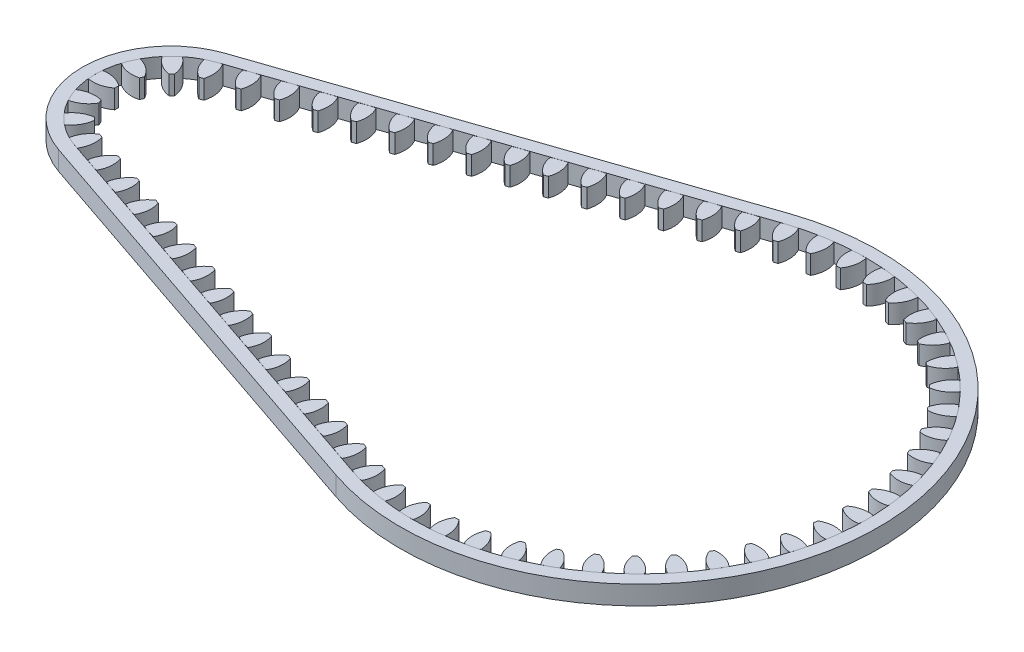
from build123d import *

# Parameters (mm, degrees)
BOSS_EXTRUDE1_DEPTH = 6
BOSS_EXTRUDE2_DEPTH = 6
CRVPATTERN1_DEPTH   = 6


# Read off the part's stored shape, not the designer's step: CrvPattern1
with BuildPart() as part:
    # Sketch1 → Boss-Extrude1 (new body)
    with BuildSketch(Plane(origin=(0, 0, 0), x_dir=(1, 0, 0), z_dir=(0, 1, 0))):
        with BuildLine():
            Line((-9.020134228, -26.507304248), (124.516778523, -71.948397245))
            ThreePointArc((124.516778523, -71.948397245), (225, 0), (124.516778523, 71.948397245))
            Line((124.516778523, 71.948397245), (-9.020134228, 26.507304248))
            ThreePointArc((-9.020134228, 26.507304248), (-28, 0), (-9.020134228, -26.507304248))
        make_face()
        with BuildLine():
            ThreePointArc((125.805369128, -68.161639495), (221, 0), (125.805369128, 68.161639495))
            Line((125.805369128, 68.161639495), (-7.731543624, 22.720546498))
            ThreePointArc((-7.731543624, 22.720546498), (-24, 0), (-7.731543624, -22.720546498))
            Line((-7.731543624, -22.720546498), (125.805369128, -68.161639495))
        make_face(mode=Mode.SUBTRACT)
    extrude(amount=BOSS_EXTRUDE1_DEPTH)


with BuildPart() as body_2:
    # Sketch4 → Boss-Extrude2 (new body)
    with BuildSketch(Plane(origin=(0, 0, 0), x_dir=(-1, 0, 0), z_dir=(0, -1, 0))):
        with BuildLine():
            ThreePointArc((17.101526887, -0.635252012), (20.322077388, -2.182192533), (23.894229865, -2.250728579))
            ThreePointArc((23.894229865, -2.250728579), (24, 0), (23.894229865, 2.250728579))
            ThreePointArc((23.894229865, 2.250728579), (20.322077388, 2.182192533), (17.101526887, 0.635252012))
            ThreePointArc((17.101526887, 0.635252012), (17.093118224, 0), (17.101526887, -0.635252012))
        make_face()
    extrude(amount=-BOSS_EXTRUDE2_DEPTH)


with BuildPart() as body_3:
    # CrvPattern1 outline → CrvPattern1 (new body)
    with BuildSketch(Plane(origin=(0, 0, 0), x_dir=(1, 0, 0), z_dir=(0, 1, 0))):
        with BuildLine():
            ThreePointArc((-21.125479122, -11.389211204), (-17.862776307, -9.933278222), (-15.500293176, -7.253046149))
            ThreePointArc((-15.500293176, -7.253046149), (-15.740241757, -6.664794075), (-15.995676615, -6.08309926))
            ThreePointArc((-15.995676615, -6.08309926), (-19.564497862, -5.91432304), (-22.880646588, -7.244032835))
            ThreePointArc((-22.880646588, -7.244032835), (-22.100461555, -9.357862954), (-21.125479122, -11.389211204))
        make_face()
        with BuildLine():
            ThreePointArc((-18.245884714, -15.591269704), (-16.703318632, -17.233663183), (-15.013526527, -18.724156088))
            ThreePointArc((-15.013526527, -18.724156088), (-12.576623448, -16.11140392), (-11.446022228, -12.722198793))
            ThreePointArc((-11.446022228, -12.722198793), (-11.896325005, -12.274043425), (-12.358332162, -11.837964063))
            ThreePointArc((-12.358332162, -11.837964063), (-15.710554375, -13.07391582), (-18.245884714, -15.591269704))
        make_face()
        with BuildLine():
            ThreePointArc((-10.722052923, -21.471785699), (-8.661168144, -22.382675586), (-6.523942288, -23.096280588))
            ThreePointArc((-6.523942288, -23.096280588), (-5.29873424, -19.740116744), (-5.579190008, -16.178331368))
            ThreePointArc((-5.579190008, -16.178331368), (-6.168598793, -15.941238331), (-6.764076649, -15.719829327))
            ThreePointArc((-6.764076649, -15.719829327), (-9.369009868, -18.165088707), (-10.722052923, -21.471785699))
        make_face()
        with BuildLine():
            ThreePointArc((-6.523942289, 23.096280588), (-8.661168144, 22.382675586), (-10.722052923, 21.471785699))
            ThreePointArc((-10.722052923, 21.471785699), (-9.369009868, 18.165088707), (-6.76407665, 15.719829327))
            ThreePointArc((-6.76407665, 15.719829327), (-6.168598794, 15.941238331), (-5.579190008, 16.178331367))
            ThreePointArc((-5.579190008, 16.178331367), (-5.29873424, 19.740116744), (-6.523942289, 23.096280588))
        make_face()
        with BuildLine():
            ThreePointArc((-15.013526527, 18.724156088), (-16.703318632, 17.233663183), (-18.245884714, 15.591269704))
            ThreePointArc((-18.245884714, 15.591269704), (-15.710554375, 13.07391582), (-12.358332162, 11.837964063))
            ThreePointArc((-12.358332162, 11.837964063), (-11.896325004, 12.274043425), (-11.446022228, 12.722198793))
            ThreePointArc((-11.446022228, 12.722198793), (-12.576623448, 16.11140392), (-15.013526527, 18.724156088))
        make_face()
        with BuildLine():
            ThreePointArc((-21.125479122, 11.389211204), (-22.100461555, 9.357862954), (-22.880646588, 7.244032835))
            ThreePointArc((-22.880646588, 7.244032835), (-19.564497862, 5.91432304), (-15.995676615, 6.08309926))
            ThreePointArc((-15.995676615, 6.08309926), (-15.740241757, 6.664794075), (-15.500293176, 7.253046149))
            ThreePointArc((-15.500293176, 7.253046149), (-17.862776307, 9.933278222), (-21.125479122, 11.389211204))
        make_face()
        with BuildLine():
            ThreePointArc((2.596033966, -26.123177392), (3.681912144, -22.719379647), (3.254932671, -19.172175249))
            ThreePointArc((3.254932671, -19.172175249), (2.656255133, -18.959569913), (2.052159932, -18.762885362))
            ThreePointArc((2.052159932, -18.762885362), (-0.449805099, -21.31340325), (-1.665447979, -24.673043543))
            ThreePointArc((-1.665447979, -24.673043543), (0.431219393, -25.498241936), (2.596033966, -26.123177392))
        make_face()
        with BuildLine():
            ThreePointArc((11.696335101, -29.219906391), (12.78221328, -25.816108646), (12.355233807, -22.268904249))
            ThreePointArc((12.355233807, -22.268904249), (11.756556268, -22.056298913), (11.152461067, -21.859614362))
            ThreePointArc((11.152461067, -21.859614362), (8.650496036, -24.410132249), (7.434853156, -27.769772542))
            ThreePointArc((7.434853156, -27.769772542), (9.531520528, -28.594970936), (11.696335101, -29.219906391))
        make_face()
        with BuildLine():
            ThreePointArc((20.796636236, -32.316635391), (21.882514415, -28.912837646), (21.455534942, -25.365633248))
            ThreePointArc((21.455534942, -25.365633248), (20.856857404, -25.153027912), (20.252762203, -24.956343361))
            ThreePointArc((20.252762203, -24.956343361), (17.750797172, -27.506861248), (16.535154292, -30.866501541))
            ThreePointArc((16.535154292, -30.866501541), (18.631821664, -31.691699935), (20.796636236, -32.316635391))
        make_face()
        with BuildLine():
            ThreePointArc((29.895921487, -35.413018696), (30.981799665, -32.009220951), (30.554820192, -28.462016553))
            ThreePointArc((30.554820192, -28.462016553), (29.956142654, -28.249411217), (29.352047453, -28.052726666))
            ThreePointArc((29.352047453, -28.052726666), (26.850082422, -30.603244553), (25.634439542, -33.962884846))
            ThreePointArc((25.634439542, -33.962884846), (27.731106914, -34.78808324), (29.895921487, -35.413018696))
        make_face()
        with BuildLine():
            ThreePointArc((38.995206737, -38.509402001), (40.081084915, -35.105604256), (39.654105442, -31.558399858))
            ThreePointArc((39.654105442, -31.558399858), (39.055427904, -31.345794522), (38.451332703, -31.149109971))
            ThreePointArc((38.451332703, -31.149109971), (35.949367672, -33.699627858), (34.733724792, -37.059268151))
            ThreePointArc((34.733724792, -37.059268151), (36.830392164, -37.884466545), (38.995206737, -38.509402001))
        make_face()
        with BuildLine():
            ThreePointArc((48.095507872, -41.606131), (49.181386051, -38.202333255), (48.754406578, -34.655128857))
            ThreePointArc((48.754406578, -34.655128857), (48.155729039, -34.442523522), (47.551633838, -34.245838971))
            ThreePointArc((47.551633838, -34.245838971), (45.049668808, -36.796356859), (43.834025927, -40.155997151))
            ThreePointArc((43.834025927, -40.155997151), (45.930693299, -40.981195545), (48.095507872, -41.606131))
        make_face()
        with BuildLine():
            ThreePointArc((57.195809008, -44.702859999), (58.281687186, -41.299062254), (57.854707713, -37.751857857))
            ThreePointArc((57.854707713, -37.751857857), (57.256030175, -37.539252521), (56.651934974, -37.34256797))
            ThreePointArc((56.651934974, -37.34256797), (54.149969943, -39.893085857), (52.934327063, -43.25272615))
            ThreePointArc((52.934327063, -43.25272615), (55.030994435, -44.077924544), (57.195809008, -44.702859999))
        make_face()
        with BuildLine():
            ThreePointArc((66.296110143, -47.799588999), (67.381988322, -44.395791254), (66.955008849, -40.848586856))
            ThreePointArc((66.955008849, -40.848586856), (66.35633131, -40.63598152), (65.752236109, -40.439296969))
            ThreePointArc((65.752236109, -40.439296969), (63.250271078, -42.989814856), (62.034628198, -46.349455149))
            ThreePointArc((62.034628198, -46.349455149), (64.13129557, -47.174653543), (66.296110143, -47.799588999))
        make_face()
        with BuildLine():
            ThreePointArc((75.396411279, -50.896317998), (76.482289457, -47.492520253), (76.055309984, -43.945315855))
            ThreePointArc((76.055309984, -43.945315855), (75.456632446, -43.732710519), (74.852537245, -43.536025968))
            ThreePointArc((74.852537245, -43.536025968), (72.350572214, -46.086543856), (71.134929334, -49.446184149))
            ThreePointArc((71.134929334, -49.446184149), (73.231596706, -50.271382543), (75.396411279, -50.896317998))
        make_face()
        with BuildLine():
            ThreePointArc((84.495696529, -53.992701303), (85.581574707, -50.588903558), (85.154595234, -47.04169916))
            ThreePointArc((85.154595234, -47.04169916), (84.555917695, -46.829093825), (83.951822495, -46.632409274))
            ThreePointArc((83.951822495, -46.632409274), (81.449857464, -49.182927161), (80.234214584, -52.542567454))
            ThreePointArc((80.234214584, -52.542567454), (82.330881956, -53.367765848), (84.495696529, -53.992701303))
        make_face()
        with BuildLine():
            ThreePointArc((93.594981779, -57.089084608), (94.680859958, -53.685286863), (94.253880485, -50.138082465))
            ThreePointArc((94.253880485, -50.138082465), (93.655202946, -49.92547713), (93.051107745, -49.728792579))
            ThreePointArc((93.051107745, -49.728792579), (90.549142714, -52.279310466), (89.333499834, -55.638950759))
            ThreePointArc((89.333499834, -55.638950759), (91.430167206, -56.464149153), (93.594981779, -57.089084608))
        make_face()
        with BuildLine():
            ThreePointArc((102.695282914, -60.185813608), (103.781161093, -56.782015863), (103.35418162, -53.234811465))
            ThreePointArc((103.35418162, -53.234811465), (102.755504081, -53.022206129), (102.151408881, -52.825521578))
            ThreePointArc((102.151408881, -52.825521578), (99.64944385, -55.376039465), (98.43380097, -58.735679758))
            ThreePointArc((98.43380097, -58.735679758), (100.530468342, -59.560878152), (102.695282914, -60.185813608))
        make_face()
        with BuildLine():
            ThreePointArc((111.79558405, -63.282542607), (112.881462229, -59.878744862), (112.454482755, -56.331540464))
            ThreePointArc((112.454482755, -56.331540464), (111.855805217, -56.118935128), (111.251710016, -55.922250577))
            ThreePointArc((111.251710016, -55.922250577), (108.749744985, -58.472768464), (107.534102105, -61.832408757))
            ThreePointArc((107.534102105, -61.832408757), (109.630769477, -62.657607151), (111.79558405, -63.282542607))
        make_face()
        with BuildLine():
            ThreePointArc((120.895885185, -66.379271606), (121.981763364, -62.975473861), (121.554783891, -59.428269463))
            ThreePointArc((121.554783891, -59.428269463), (120.956106352, -59.215664128), (120.352011152, -59.018979577))
            ThreePointArc((120.352011152, -59.018979577), (117.850046121, -61.569497464), (116.63440324, -64.929137757))
            ThreePointArc((116.63440324, -64.929137757), (118.731070612, -65.754336151), (120.895885185, -66.379271606))
        make_face()
        with BuildLine():
            ThreePointArc((130.02301791, -69.38097879), (131.007294776, -65.94642357), (130.475121352, -62.413469854))
            ThreePointArc((130.475121352, -62.413469854), (129.870391865, -62.218744223), (129.260720091, -62.040093301))
            ThreePointArc((129.260720091, -62.040093301), (126.835631694, -64.663815233), (125.72033555, -68.058087618))
            ThreePointArc((125.72033555, -68.058087618), (127.840592934, -68.820632754), (130.02301791, -69.38097879))
        make_face()
        with BuildLine():
            ThreePointArc((139.426681005, -71.289533808), (139.945050702, -67.754528381), (138.947366021, -64.323843932))
            ThreePointArc((138.947366021, -64.323843932), (138.322098734, -64.211342181), (137.694072726, -64.115429942))
            ThreePointArc((137.694072726, -64.115429942), (135.639787249, -67.038592901), (134.986202291, -70.551112967))
            ThreePointArc((134.986202291, -70.551112967), (137.189091073, -71.024660719), (139.426681005, -71.289533808))
        make_face()
        with BuildLine():
            ThreePointArc((149.001746129, -71.929451993), (149.044932351, -68.356903119), (147.599443546, -65.08955976))
            ThreePointArc((147.599443546, -65.08955976), (146.964765029, -65.061293091), (146.329560693, -65.049835527))
            ThreePointArc((146.329560693, -65.049835527), (144.682681106, -68.220444007), (144.502489809, -71.788707115))
            ThreePointArc((144.502489809, -71.788707115), (146.748810905, -71.964797976), (149.001746129, -71.929451993))
        make_face()
        with BuildLine():
            ThreePointArc((158.575488081, -71.289242492), (158.142786419, -67.742731561), (156.275277532, -64.696852203))
            ThreePointArc((156.275277532, -64.696852203), (155.642483661, -64.753312278), (155.011405928, -64.826501887))
            ThreePointArc((155.011405928, -64.826501887), (153.801184775, -68.188099018), (154.097529903, -71.748597589))
            ThreePointArc((154.097529903, -71.748597589), (156.347302397, -71.624138023), (158.575488081, -71.289242492))
        make_face()
        with BuildLine():
            ThreePointArc((167.98034737, -69.380058236), (167.079382365, -65.922713508), (164.823024673, -63.152547362))
            ThreePointArc((164.823024673, -63.152547362), (164.203378795, -63.292742975), (163.587660831, -63.449290773))
            ThreePointArc((163.587660831, -63.449290773), (162.835709458, -66.942074712), (163.603393573, -70.431434482))
            ThreePointArc((163.603393573, -70.431434482), (165.816574518, -70.008591055), (167.98034737, -69.380058236))
        make_face()
        with BuildLine():
            ThreePointArc((177.046671732, -66.23617042), (175.693514728, -62.929520055), (173.088497247, -60.484350443))
            ThreePointArc((173.088497247, -60.484350443), (172.493027022, -60.705779968), (171.903626407, -60.942893315))
            ThreePointArc((171.903626407, -60.942893315), (171.623293378, -64.504688354), (172.84861708, -67.860809975))
            ThreePointArc((172.84861708, -67.860809975), (174.985818343, -67.147131324), (177.046671732, -66.23617042))
        make_face()
        with BuildLine():
            ThreePointArc((185.613835402, -61.913432503), (183.832569207, -58.8163272), (180.925254976, -56.739672565))
            ThreePointArc((180.925254976, -56.739672565), (180.364558389, -57.038395114), (179.811965085, -57.351853987))
            ThreePointArc((179.811965085, -57.351853987), (180.008239898, -60.919268556), (181.669395514, -64.082420865))
            ThreePointArc((181.669395514, -64.082420865), (183.692579886, -63.090608658), (185.613835402, -61.913432503))
        make_face()
        with BuildLine():
            ThreePointArc((193.528471483, -56.489479502), (191.350842942, -53.657006299), (188.193001595, -51.985776652))
            ThreePointArc((188.193001595, -51.985776652), (187.677051913, -52.356467561), (187.171094756, -52.74068518))
            ThreePointArc((187.171094756, -52.74068518), (187.840429071, -56.250238155), (189.907806164, -59.164156902))
            ThreePointArc((189.907806164, -59.164156902), (191.78098536, -57.911892489), (193.528471483, -56.489479502))
        make_face()
        with BuildLine():
            ThreePointArc((200.652140932, -50.058989245), (198.116829754, -47.541616062), (194.76461695, -46.305638788))
            ThreePointArc((194.76461695, -46.305638788), (194.302606473, -46.741714633), (193.852300285, -47.189866574))
            ThreePointArc((193.852300285, -47.189866574), (194.982875707, -50.579080306), (197.419758897, -53.191851024))
            ThreePointArc((197.419758897, -53.191851024), (199.109562347, -51.701370981), (200.652140932, -50.058989245))
        make_face()
        with BuildLine():
            ThreePointArc((206.855177416, -42.739027987), (204.007373926, -40.581486379), (200.520482961, -39.802665534))
            ThreePointArc((200.520482961, -39.802665534), (200.120622024, -40.296352738), (199.733968508, -40.800450826))
            ThreePointArc((199.733968508, -40.800450826), (201.305570649, -44.009038867), (204.068518697, -46.274229498))
            ThreePointArc((204.068518697, -46.274229498), (205.544914212, -44.572106488), (206.855177416, -42.739027987))
        make_face()
        with BuildLine():
            ThreePointArc((212.030087364, -34.656228213), (208.920396992, -32.897024899), (205.360859377, -32.589352224))
            ThreePointArc((205.360859377, -32.589352224), (205.030283225, -33.131878935), (204.714182944, -33.682965531))
            ThreePointArc((204.714182944, -33.682965531), (206.698959741, -36.653761986), (209.738881509, -38.530953014))
            ThreePointArc((209.738881509, -38.530953014), (210.975528325, -36.64742677), (212.030087364, -34.656228213))
        make_face()
        with BuildLine():
            ThreePointArc((216.082169183, -25.958209584), (212.76598975, -24.628576371), (209.197172401, -24.797435009))
            ThreePointArc((209.197172401, -24.797435009), (208.941750976, -25.379135722), (208.701815981, -25.967393337))
            ThreePointArc((208.701815981, -25.967393337), (211.064361007, -28.647570851), (214.327097444, -30.103428486))
            ThreePointArc((214.327097444, -30.103428486), (215.302032966, -28.07205772), (216.082169183, -25.958209584))
        make_face()
        with BuildLine():
            ThreePointArc((218.940193615, -16.799267371), (215.476553537, -15.922815476), (211.961958408, -16.565148401))
            ThreePointArc((211.961958408, -16.565148401), (211.786228216, -17.175668445), (211.626719347, -17.790625959))
            ThreePointArc((211.626719347, -17.790625959), (214.3249536, -20.132527413), (217.752425418, -21.141193586))
            ThreePointArc((217.752425418, -21.141193586), (218.448331174, -18.998139308), (218.940193615, -16.799267371))
        make_face()
        with BuildLine():
            ThreePointArc((220.554079041, -7.338926335), (217.004590128, -6.931373928), (213.606788495, -8.03587136))
            ThreePointArc((213.606788495, -8.03587136), (213.513898148, -8.664351437), (213.437675482, -9.295070019))
            ThreePointArc((213.437675482, -9.295070019), (216.423659807, -11.256923254), (219.954903462, -11.800328039))
            ThreePointArc((219.954903462, -11.800328039), (220.359320208, -9.583705935), (220.554079041, -7.338926335))
        make_face()
        with BuildLine():
            ThreePointArc((220.894229865, 2.250728579), (217.322077388, 2.182192533), (214.101526887, 0.635252012))
            ThreePointArc((214.101526887, 0.635252012), (214.093118224, 0), (214.101526887, -0.635252012))
            ThreePointArc((214.101526887, -0.635252012), (217.322077388, -2.182192533), (220.894229865, -2.250728579))
            ThreePointArc((220.894229865, -2.250728579), (221, 0), (220.894229865, 2.250728579))
        make_face()
        with BuildLine():
            ThreePointArc((219.954903462, 11.800328039), (216.423659807, 11.256923254), (213.437675482, 9.295070018))
            ThreePointArc((213.437675482, 9.295070018), (213.513898148, 8.664351436), (213.606788495, 8.035871359))
            ThreePointArc((213.606788495, 8.035871359), (217.004590128, 6.931373928), (220.554079041, 7.338926334))
            ThreePointArc((220.554079041, 7.338926334), (220.359320208, 9.583705935), (219.954903462, 11.800328039))
        make_face()
        with BuildLine():
            ThreePointArc((217.752425418, 21.141193585), (214.3249536, 20.132527413), (211.626719347, 17.790625958))
            ThreePointArc((211.626719347, 17.790625958), (211.786228216, 17.175668444), (211.961958408, 16.5651484))
            ThreePointArc((211.961958408, 16.5651484), (215.476553537, 15.922815476), (218.940193615, 16.79926737))
            ThreePointArc((218.940193615, 16.79926737), (218.448331174, 18.998139307), (217.752425418, 21.141193585))
        make_face()
        with BuildLine():
            ThreePointArc((214.327097444, 30.103428485), (211.064361007, 28.64757085), (208.701815981, 25.967393336))
            ThreePointArc((208.701815981, 25.967393336), (208.941750977, 25.379135721), (209.197172402, 24.797435008))
            ThreePointArc((209.197172402, 24.797435008), (212.765989751, 24.628576371), (216.082169183, 25.958209584))
            ThreePointArc((216.082169183, 25.958209584), (215.302032966, 28.07205772), (214.327097444, 30.103428485))
        make_face()
        with BuildLine():
            ThreePointArc((209.738881509, 38.530953013), (206.698959741, 36.653761986), (204.714182945, 33.682965531))
            ThreePointArc((204.714182945, 33.682965531), (205.030283226, 33.131878935), (205.360859377, 32.589352224))
            ThreePointArc((205.360859377, 32.589352224), (208.920396993, 32.897024898), (212.030087364, 34.656228213))
            ThreePointArc((212.030087364, 34.656228213), (210.975528325, 36.647426769), (209.738881509, 38.530953013))
        make_face()
        with BuildLine():
            ThreePointArc((204.068518697, 46.274229498), (201.305570649, 44.009038867), (199.733968508, 40.800450825))
            ThreePointArc((199.733968508, 40.800450825), (200.120622025, 40.296352737), (200.520482961, 39.802665533))
            ThreePointArc((200.520482961, 39.802665533), (204.007373926, 40.581486378), (206.855177416, 42.739027986))
            ThreePointArc((206.855177416, 42.739027986), (205.544914212, 44.572106488), (204.068518697, 46.274229498))
        make_face()
        with BuildLine():
            ThreePointArc((197.419758898, 53.191851024), (194.982875707, 50.579080306), (193.852300285, 47.189866574))
            ThreePointArc((193.852300285, 47.189866574), (194.302606473, 46.741714633), (194.76461695, 46.305638788))
            ThreePointArc((194.76461695, 46.305638788), (198.116829755, 47.541616062), (200.652140932, 50.058989245))
            ThreePointArc((200.652140932, 50.058989245), (199.109562348, 51.701370981), (197.419758898, 53.191851024))
        make_face()
        with BuildLine():
            ThreePointArc((189.907806165, 59.164156902), (187.840429071, 56.250238155), (187.171094756, 52.74068518))
            ThreePointArc((187.171094756, 52.74068518), (187.677051914, 52.35646756), (188.193001596, 51.985776651))
            ThreePointArc((188.193001596, 51.985776651), (191.350842943, 53.657006299), (193.528471484, 56.489479502))
            ThreePointArc((193.528471484, 56.489479502), (191.78098536, 57.911892489), (189.907806165, 59.164156902))
        make_face()
        with BuildLine():
            ThreePointArc((181.669395514, 64.082420864), (180.008239898, 60.919268555), (179.811965086, 57.351853986))
            ThreePointArc((179.811965086, 57.351853986), (180.36455839, 57.038395114), (180.925254977, 56.739672565))
            ThreePointArc((180.925254977, 56.739672565), (183.832569208, 58.8163272), (185.613835402, 61.913432502))
            ThreePointArc((185.613835402, 61.913432502), (183.692579887, 63.090608658), (181.669395514, 64.082420864))
        make_face()
        with BuildLine():
            ThreePointArc((172.84861708, 67.860809975), (171.623293379, 64.504688354), (171.903626408, 60.942893314))
            ThreePointArc((171.903626408, 60.942893314), (172.493027022, 60.705779967), (173.088497248, 60.484350443))
            ThreePointArc((173.088497248, 60.484350443), (175.693514729, 62.929520055), (177.046671732, 66.236170419))
            ThreePointArc((177.046671732, 66.236170419), (174.985818344, 67.147131324), (172.84861708, 67.860809975))
        make_face()
        with BuildLine():
            ThreePointArc((163.603393574, 70.431434482), (162.835709458, 66.942074712), (163.587660831, 63.449290773))
            ThreePointArc((163.587660831, 63.449290773), (164.203378795, 63.292742975), (164.823024673, 63.152547362))
            ThreePointArc((164.823024673, 63.152547362), (167.079382366, 65.922713507), (167.98034737, 69.380058236))
            ThreePointArc((167.98034737, 69.380058236), (165.816574519, 70.008591055), (163.603393574, 70.431434482))
        make_face()
        with BuildLine():
            ThreePointArc((154.097529904, 71.748597589), (153.801184776, 68.188099018), (155.011405928, 64.826501887))
            ThreePointArc((155.011405928, 64.826501887), (155.642483661, 64.753312278), (156.275277533, 64.696852203))
            ThreePointArc((156.275277533, 64.696852203), (158.14278642, 67.742731561), (158.575488082, 71.289242492))
            ThreePointArc((158.575488082, 71.289242492), (156.347302398, 71.624138023), (154.097529904, 71.748597589))
        make_face()
        with BuildLine():
            ThreePointArc((144.50248981, 71.788707114), (144.682681107, 68.220444007), (146.329560694, 65.049835527))
            ThreePointArc((146.329560694, 65.049835527), (146.96476503, 65.061293091), (147.599443547, 65.08955976))
            ThreePointArc((147.599443547, 65.08955976), (149.044932352, 68.356903119), (149.001746129, 71.929451993))
            ThreePointArc((149.001746129, 71.929451993), (146.748810906, 71.964797976), (144.50248981, 71.788707114))
        make_face()
        with BuildLine():
            ThreePointArc((134.986202291, 70.551112967), (135.639787249, 67.038592901), (137.694072727, 64.115429942))
            ThreePointArc((137.694072727, 64.115429942), (138.322098734, 64.211342181), (138.947366021, 64.323843932))
            ThreePointArc((138.947366021, 64.323843932), (139.945050702, 67.754528381), (139.426681005, 71.289533808))
            ThreePointArc((139.426681005, 71.289533808), (137.189091073, 71.024660719), (134.986202291, 70.551112967))
        make_face()
        with BuildLine():
            ThreePointArc((125.72033555, 68.058087618), (126.835631695, 64.663815233), (129.260720092, 62.040093301))
            ThreePointArc((129.260720092, 62.040093301), (129.870391866, 62.218744223), (130.475121353, 62.413469854))
            ThreePointArc((130.475121353, 62.413469854), (131.007294776, 65.94642357), (130.023017911, 69.38097879))
            ThreePointArc((130.023017911, 69.38097879), (127.840592934, 68.820632754), (125.72033555, 68.058087618))
        make_face()
        with BuildLine():
            ThreePointArc((116.634403241, 64.929137757), (117.850046121, 61.569497464), (120.352011152, 59.018979577))
            ThreePointArc((120.352011152, 59.018979577), (120.956106353, 59.215664128), (121.554783892, 59.428269464))
            ThreePointArc((121.554783892, 59.428269464), (121.981763365, 62.975473861), (120.895885186, 66.379271606))
            ThreePointArc((120.895885186, 66.379271606), (118.731070613, 65.754336151), (116.634403241, 64.929137757))
        make_face()
        with BuildLine():
            ThreePointArc((107.534102106, 61.832408757), (108.749744986, 58.472768464), (111.251710017, 55.922250577))
            ThreePointArc((111.251710017, 55.922250577), (111.855805217, 56.118935128), (112.454482756, 56.331540464))
            ThreePointArc((112.454482756, 56.331540464), (112.881462229, 59.878744862), (111.79558405, 63.282542607))
            ThreePointArc((111.79558405, 63.282542607), (109.630769477, 62.657607151), (107.534102106, 61.832408757))
        make_face()
        with BuildLine():
            ThreePointArc((98.43380097, 58.735679758), (99.64944385, 55.376039465), (102.151408881, 52.825521578))
            ThreePointArc((102.151408881, 52.825521578), (102.755504082, 53.022206129), (103.354181621, 53.234811465))
            ThreePointArc((103.354181621, 53.234811465), (103.781161094, 56.782015863), (102.695282915, 60.185813608))
            ThreePointArc((102.695282915, 60.185813608), (100.530468342, 59.560878152), (98.43380097, 58.735679758))
        make_face()
        with BuildLine():
            ThreePointArc((89.333499835, 55.638950759), (90.549142715, 52.279310466), (93.051107746, 49.728792579))
            ThreePointArc((93.051107746, 49.728792579), (93.655202947, 49.92547713), (94.253880485, 50.138082466))
            ThreePointArc((94.253880485, 50.138082466), (94.680859958, 53.685286863), (93.594981779, 57.089084608))
            ThreePointArc((93.594981779, 57.089084608), (91.430167206, 56.464149153), (89.333499835, 55.638950759))
        make_face()
        with BuildLine():
            ThreePointArc((80.234214584, 52.542567454), (81.449857465, 49.182927161), (83.951822496, 46.632409274))
            ThreePointArc((83.951822496, 46.632409274), (84.555917696, 46.829093825), (85.154595235, 47.041699161))
            ThreePointArc((85.154595235, 47.041699161), (85.581574708, 50.588903558), (84.495696529, 53.992701303))
            ThreePointArc((84.495696529, 53.992701303), (82.330881956, 53.367765848), (80.234214584, 52.542567454))
        make_face()
        with BuildLine():
            ThreePointArc((71.134929334, 49.446184149), (72.350572215, 46.086543856), (74.852537246, 43.536025969))
            ThreePointArc((74.852537246, 43.536025969), (75.456632446, 43.73271052), (76.055309985, 43.945315856))
            ThreePointArc((76.055309985, 43.945315856), (76.482289458, 47.492520253), (75.396411279, 50.896317998))
            ThreePointArc((75.396411279, 50.896317998), (73.231596706, 50.271382543), (71.134929334, 49.446184149))
        make_face()
        with BuildLine():
            ThreePointArc((62.034628199, 46.349455149), (63.250271079, 42.989814856), (65.75223611, 40.439296969))
            ThreePointArc((65.75223611, 40.439296969), (66.356331311, 40.63598152), (66.95500885, 40.848586856))
            ThreePointArc((66.95500885, 40.848586856), (67.381988322, 44.395791254), (66.296110144, 47.799588999))
            ThreePointArc((66.296110144, 47.799588999), (64.131295571, 47.174653543), (62.034628199, 46.349455149))
        make_face()
        with BuildLine():
            ThreePointArc((52.934327063, 43.25272615), (54.149969944, 39.893085857), (56.651934975, 37.34256797))
            ThreePointArc((56.651934975, 37.34256797), (57.256030175, 37.539252521), (57.854707714, 37.751857857))
            ThreePointArc((57.854707714, 37.751857857), (58.281687187, 41.299062255), (57.195809008, 44.70286))
            ThreePointArc((57.195809008, 44.70286), (55.030994435, 44.077924544), (52.934327063, 43.25272615))
        make_face()
        with BuildLine():
            ThreePointArc((43.834025928, 40.155997151), (45.049668808, 36.796356858), (47.551633839, 34.245838971))
            ThreePointArc((47.551633839, 34.245838971), (48.15572904, 34.442523522), (48.754406579, 34.655128858))
            ThreePointArc((48.754406579, 34.655128858), (49.181386052, 38.202333255), (48.095507873, 41.606131))
            ThreePointArc((48.095507873, 41.606131), (45.9306933, 40.981195545), (43.834025928, 40.155997151))
        make_face()
        with BuildLine():
            ThreePointArc((34.733724792, 37.059268151), (35.949367673, 33.699627859), (38.451332704, 31.149109971))
            ThreePointArc((38.451332704, 31.149109971), (39.055427904, 31.345794522), (39.654105443, 31.558399858))
            ThreePointArc((39.654105443, 31.558399858), (40.081084916, 35.105604256), (38.995206737, 38.509402001))
            ThreePointArc((38.995206737, 38.509402001), (36.830392164, 37.884466545), (34.733724792, 37.059268151))
        make_face()
        with BuildLine():
            ThreePointArc((25.634439542, 33.962884846), (26.850082423, 30.603244554), (29.352047454, 28.052726666))
            ThreePointArc((29.352047454, 28.052726666), (29.956142654, 28.249411217), (30.554820193, 28.462016553))
            ThreePointArc((30.554820193, 28.462016553), (30.981799666, 32.009220951), (29.895921487, 35.413018696))
            ThreePointArc((29.895921487, 35.413018696), (27.731106914, 34.78808324), (25.634439542, 33.962884846))
        make_face()
        with BuildLine():
            ThreePointArc((16.535154292, 30.866501541), (17.750797172, 27.506861248), (20.252762203, 24.956343361))
            ThreePointArc((20.252762203, 24.956343361), (20.856857404, 25.153027912), (21.455534943, 25.365633248))
            ThreePointArc((21.455534943, 25.365633248), (21.882514416, 28.912837646), (20.796636237, 32.316635391))
            ThreePointArc((20.796636237, 32.316635391), (18.631821664, 31.691699935), (16.535154292, 30.866501541))
        make_face()
        with BuildLine():
            ThreePointArc((7.434853157, 27.769772542), (8.650496037, 24.410132249), (11.152461068, 21.859614362))
            ThreePointArc((11.152461068, 21.859614362), (11.756556269, 22.056298913), (12.355233807, 22.268904249))
            ThreePointArc((12.355233807, 22.268904249), (12.78221328, 25.816108647), (11.696335101, 29.219906392))
            ThreePointArc((11.696335101, 29.219906392), (9.531520529, 28.594970936), (7.434853157, 27.769772542))
        make_face()
        with BuildLine():
            ThreePointArc((-1.665447979, 24.673043543), (-0.449805099, 21.31340325), (2.052159932, 18.762885363))
            ThreePointArc((2.052159932, 18.762885363), (2.656255133, 18.959569914), (3.254932672, 19.17217525))
            ThreePointArc((3.254932672, 19.17217525), (3.681912145, 22.719379647), (2.596033966, 26.123177392))
            ThreePointArc((2.596033966, 26.123177392), (0.431219393, 25.498241937), (-1.665447979, 24.673043543))
        make_face()
    extrude(amount=CRVPATTERN1_DEPTH)


solid = Compound([part.part, body_2.part, body_3.part])
